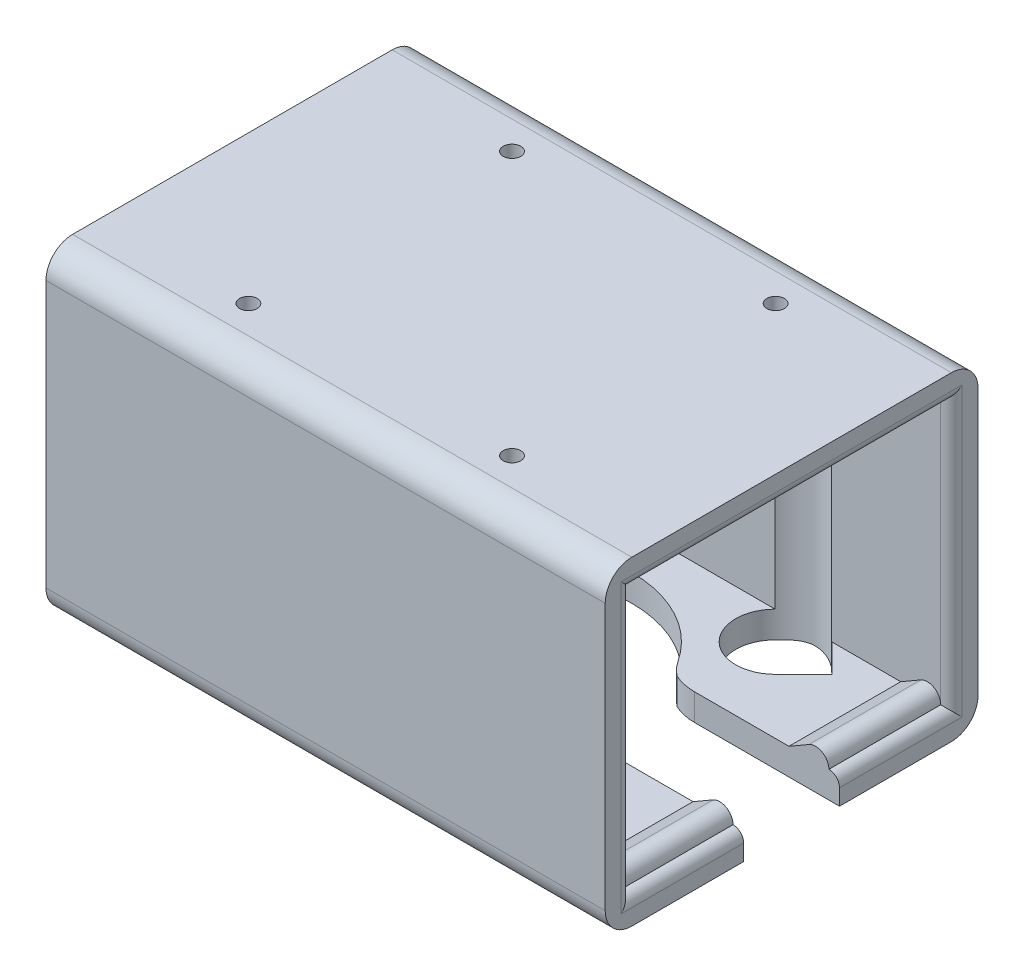
from build123d import *

# Parameters (mm, degrees)
EXTRUDE_1_DEPTH     = 5
SKETCH_3_W          = 100
SKETCH_3_H          = 5
SKETCH_3_W_2        = 5
SKETCH_3_H_2        = 60
EXTRUDE_2_DEPTH     = 55
SKETCH_4_W          = 60
SKETCH_4_H          = 5
EXTRUDE_3_DEPTH     = 100
CUT_EXTRUDE_1_REACH = 89.07
FILLET_2_R          = 10
FILLET_3_R          = 10
FILLET_4_R          = 5
FILLET_5_R          = 2
CUT_EXTRUDE_2_REACH = 85.703
SKETCH_6_R          = 1.65
CUT_EXTRUDE_START   = -50
CUT_EXTRUDE_3_DEPTH = 50
EXTRUDE_4_DEPTH     = 60
SKETCH_10_W         = 7.5
SKETCH_10_H         = 18
CUT_EXTRUDE_4_DEPTH = 5


# Read off the part's stored shape, not the designer's step: 切除-拉伸3
with BuildPart() as part:
    # 草图1 → 凸台-拉伸1 (new body)
    with BuildSketch(Plane(origin=(0, 0, 0), x_dir=(1, 0, 0), z_dir=(0, 1, 0))):
        Polygon((-52.5, 35), (-52.5, -35), (52.5, -35), (52.5, -9), (-20, -9), (-20, 9), (52.5, 9), (52.5, 35), align=None)
    extrude(amount=EXTRUDE_1_DEPTH)

    # 草图3 → 凸台-拉伸2 (add)
    with BuildSketch(Plane(origin=(0, 5, 0), x_dir=(1, 0, 0), z_dir=(0, 1, 0))):
        with Locations((2.5, 32.5)):
            Rectangle(SKETCH_3_W, SKETCH_3_H)
        with Locations((-50, 32.5)):
            Rectangle(SKETCH_3_W_2, SKETCH_3_H)
        with Locations((-50, 0)):
            Rectangle(SKETCH_3_W_2, SKETCH_3_H_2)
        with Locations((2.5, -32.5)):
            Rectangle(SKETCH_3_W, SKETCH_3_H)
        with Locations((-50, -32.5)):
            Rectangle(SKETCH_3_W_2, SKETCH_3_H)
    extrude(amount=EXTRUDE_2_DEPTH)

    # 草图4 → 凸台-拉伸3 (add)
    with BuildSketch(Plane(origin=(-47.5, 0, 0), x_dir=(0, 0, -1), z_dir=(1, 0, 0))):
        with Locations((0, 57.5)):
            Rectangle(SKETCH_4_W, SKETCH_4_H)
    extrude(amount=EXTRUDE_3_DEPTH)

    # 草图5 → 切除-拉伸1 (cut, up to next)
    with BuildSketch(Plane.XZ, mode=Mode.PRIVATE) as cut_extrude_1_sk1:
        with BuildLine():
            Line((19.852941176, 10.588235294), (0, 22.5))
            ThreePointArc((0, 22.5), (-22.5, 0), (0, -22.5))
            Line((0, -22.5), (19.852941176, -10.588235294))
            ThreePointArc((19.852941176, -10.588235294), (20.252840641, -9.801655267), (20.621590627, -9))
            Line((20.621590627, -9), (-20, -9))
            Line((-20, -9), (-20, 9))
            Line((-20, 9), (20.621590627, 9))
            ThreePointArc((20.621590627, 9), (20.252840641, 9.801655267), (19.852941176, 10.588235294))
        make_face()
    cut_extrude_1_tool1 = extrude(cut_extrude_1_sk1.sketch, amount=-CUT_EXTRUDE_1_REACH, mode=Mode.PRIVATE) & part.part
    # 草图5 → 切除-拉伸1 (cut, up to next)
    with BuildSketch(Plane.XZ, mode=Mode.PRIVATE) as cut_extrude_1_sk2:
        with BuildLine():
            Line((22.5, 9), (19.852941176, 10.588235294))
            ThreePointArc((19.852941176, 10.588235294), (20.252840641, 9.801655267), (20.621590627, 9))
            Line((20.621590627, 9), (22.5, 9))
        make_face()
    cut_extrude_1_tool2 = extrude(cut_extrude_1_sk2.sketch, amount=-CUT_EXTRUDE_1_REACH, mode=Mode.PRIVATE) & part.part
    # 草图5 → 切除-拉伸1 (cut, up to next)
    with BuildSketch(Plane.XZ, mode=Mode.PRIVATE) as cut_extrude_1_sk3:
        with BuildLine():
            ThreePointArc((20.621590627, -9), (20.252840641, -9.801655267), (19.852941176, -10.588235294))
            Line((19.852941176, -10.588235294), (22.5, -9))
            Line((22.5, -9), (20.621590627, -9))
        make_face()
    cut_extrude_1_tool3 = extrude(cut_extrude_1_sk3.sketch, amount=-CUT_EXTRUDE_1_REACH, mode=Mode.PRIVATE) & part.part
    # 草图5 → 切除-拉伸1 (cut, up to next)
    with BuildSketch(Plane.XZ, mode=Mode.PRIVATE) as cut_extrude_1_sk4:
        with BuildLine():
            ThreePointArc((19.852941176, 10.588235294), (11.576154497, 19.293590829), (0, 22.5))
            Line((0, 22.5), (19.852941176, 10.588235294))
        make_face()
    cut_extrude_1_tool4 = extrude(cut_extrude_1_sk4.sketch, amount=-CUT_EXTRUDE_1_REACH, mode=Mode.PRIVATE) & part.part
    # 草图5 → 切除-拉伸1 (cut, up to next)
    with BuildSketch(Plane.XZ, mode=Mode.PRIVATE) as cut_extrude_1_sk5:
        with BuildLine():
            Line((19.852941176, -10.588235294), (0, -22.5))
            ThreePointArc((0, -22.5), (11.576154497, -19.293590829), (19.852941176, -10.588235294))
        make_face()
    cut_extrude_1_tool5 = extrude(cut_extrude_1_sk5.sketch, amount=-CUT_EXTRUDE_1_REACH, mode=Mode.PRIVATE) & part.part
    add(cut_extrude_1_tool1.solids().sort_by_distance((19.691832, 0, -9.530147))[0], mode=Mode.SUBTRACT)
    add(cut_extrude_1_tool2.solids().sort_by_distance((21.001859, 0, 9.525708))[0], mode=Mode.SUBTRACT)
    add(cut_extrude_1_tool3.solids().sort_by_distance((21.001859, 0, -9.525708))[0], mode=Mode.SUBTRACT)
    add(cut_extrude_1_tool4.solids().sort_by_distance((10.590548, 0, 17.650913))[0], mode=Mode.SUBTRACT)
    add(cut_extrude_1_tool5.solids().sort_by_distance((10.590548, 0, -17.650913))[0], mode=Mode.SUBTRACT)

    # 圆角2
    # the kernel refuses this fillet: 10 mm, written as the material it takes off along each edge
    with BuildSketch(Plane(origin=(19.852941176, -6.249770084, 10.588235294), x_dir=(-0.5108705169858321, 0, 0.8596576730737815), z_dir=(0, 1, 0))) as fillet_2_piece_1:
        with BuildLine():
            CenterArc((2.542282374, 9.989311313), FILLET_2_R, 241.685588385, 25.665066698)
            Line((-2.200814232, 1.185730531), (0, 0))
            ThreePointArc((0, 0), (1.040024608, 0.024049546), (2.080049215, 0))
        make_face()
    extrude(amount=17.499540168, mode=Mode.SUBTRACT)
    with BuildSketch(Plane(origin=(22.5, -6.924599124, 9), x_dir=(1, 0, 0), z_dir=(0, 1, 0))) as fillet_2_piece_2:
        with BuildLine():
            CenterArc((FILLET_2_R * 0.276983964948, -FILLET_2_R), FILLET_2_R, 90, 30.963756532)
            Line((-FILLET_2_R * 0.237511790479, -FILLET_2_R * 0.142507074287), (0, 0))
            Line((0, 0), (FILLET_2_R * 0.276983964948, 0))
        make_face()
    extrude(amount=18.849198247, mode=Mode.SUBTRACT)

    # 圆角3
    # the kernel refuses this fillet: 10 mm, written as the material it takes off along each edge
    with BuildSketch(Plane(origin=(22.5, -6.924599124, -9), x_dir=(1, 0, 0), z_dir=(0, 1, 0))) as fillet_3_piece_1:
        with BuildLine():
            CenterArc((FILLET_3_R * 0.276983964948, FILLET_3_R), FILLET_3_R, 239.036243468, 30.963756532)
            Line((-FILLET_3_R * 0.237511790479, FILLET_3_R * 0.142507074287), (0, 0))
            Line((0, 0), (FILLET_3_R * 0.276983964948, 0))
        make_face()
    extrude(amount=18.849198247, mode=Mode.SUBTRACT)
    with BuildSketch(Plane(origin=(19.852941176, -6.249770084, -10.588235294), x_dir=(0.857492925712544, 0, 0.5144957554275268), z_dir=(0, 1, 0))) as fillet_3_piece_2:
        with BuildLine():
            CenterArc((2.499908034, 10), FILLET_3_R, 244.334933302, 25.665066698)
            ThreePointArc((-1.83118813, 0.986587437), (-0.904187133, 0.514465931), (0, 0))
            Line((0, 0), (2.499908034, 0))
        make_face()
    extrude(amount=17.499540168, mode=Mode.SUBTRACT)

    # 圆角4
    fillet_4_edges = [part.edges().sort_by_distance(p)[0] for p in [
        (0, 0, 35),
        (0, 0, -35),
        (0, 60, -35),
        (0, 60, 35),
    ]]
    fillet(fillet_4_edges, radius=FILLET_4_R)

    # 圆角5
    fillet_5_edges = [part.edges().sort_by_distance(p)[0] for p in [
        (52.5, 5, 19.5),
        (52.5, 5, -19.5),
        (52.5, 30, -30),
        (52.5, 30, 30),
        (52.5, 55, 0),
    ]]
    fillet(fillet_5_edges, radius=FILLET_5_R)

    # 草图6 → 切除-拉伸2 (cut, up to next)
    with BuildSketch(Plane.XZ.offset(-55), mode=Mode.PRIVATE) as cut_extrude_2_sk1:
        with Locations(Location((-24.75, 24.75, 0), (0, 0, 270))):
            Circle(SKETCH_6_R)
    cut_extrude_2_tool1 = extrude(cut_extrude_2_sk1.sketch, amount=-CUT_EXTRUDE_2_REACH, mode=Mode.PRIVATE) & part.part
    # 草图6 → 切除-拉伸2 (cut, up to next)
    with BuildSketch(Plane.XZ.offset(-55), mode=Mode.PRIVATE) as cut_extrude_2_sk2:
        with Locations(Location((24.75, 24.75, 0), (0, 0, 270))):
            Circle(SKETCH_6_R)
    cut_extrude_2_tool2 = extrude(cut_extrude_2_sk2.sketch, amount=-CUT_EXTRUDE_2_REACH, mode=Mode.PRIVATE) & part.part
    # 草图6 → 切除-拉伸2 (cut, up to next)
    with BuildSketch(Plane.XZ.offset(-55), mode=Mode.PRIVATE) as cut_extrude_2_sk3:
        with Locations(Location((24.75, -24.75, 0), (0, 0, 270))):
            Circle(SKETCH_6_R)
    cut_extrude_2_tool3 = extrude(cut_extrude_2_sk3.sketch, amount=-CUT_EXTRUDE_2_REACH, mode=Mode.PRIVATE) & part.part
    # 草图6 → 切除-拉伸2 (cut, up to next)
    with BuildSketch(Plane.XZ.offset(-55), mode=Mode.PRIVATE) as cut_extrude_2_sk4:
        with Locations(Location((-24.75, -24.75, 0), (0, 0, 270))):
            Circle(SKETCH_6_R)
    cut_extrude_2_tool4 = extrude(cut_extrude_2_sk4.sketch, amount=-CUT_EXTRUDE_2_REACH, mode=Mode.PRIVATE) & part.part
    add(cut_extrude_2_tool1.solids().sort_by_distance((-24.75, 55, 24.75))[0], mode=Mode.SUBTRACT)
    add(cut_extrude_2_tool2.solids().sort_by_distance((24.75, 55, 24.75))[0], mode=Mode.SUBTRACT)
    add(cut_extrude_2_tool3.solids().sort_by_distance((24.75, 55, -24.75))[0], mode=Mode.SUBTRACT)
    add(cut_extrude_2_tool4.solids().sort_by_distance((-24.75, 55, -24.75))[0], mode=Mode.SUBTRACT)

    # 切除-拉伸3 outline → 切除-拉伸3 (cut)
    with BuildSketch(Plane.XZ.offset(CUT_EXTRUDE_START)):
        with BuildLine():
            Line((30, 19.393928679), (35.25210063, 24.75))
            Line((35.25210063, 24.75), (30.106071321, 30))
            ThreePointArc((30.106071321, 30), (17.250375047, 24.82500375), (30, 19.393928679))
        make_face()
        with BuildLine():
            Line((-14.143398282, 24.75), (-19.393398282, 30))
            Line((-19.393398282, 30), (-19.5, 30))
            Line((-19.5, 30), (-19.446699141, 30.053300859))
            ThreePointArc((-19.446699141, 30.053300859), (-32.25, 24.75), (-19.446699141, 19.446699141))
            Line((-19.446699141, 19.446699141), (-14.143398282, 24.75))
        make_face()
        with BuildLine():
            Line((-19.5, -30), (-19.393398282, -30))
            Line((-19.393398282, -30), (-14.143398282, -24.75))
            Line((-14.143398282, -24.75), (-19.446699141, -19.446699141))
            ThreePointArc((-19.446699141, -19.446699141), (-32.25, -24.75), (-19.446699141, -30.053300859))
            Line((-19.446699141, -30.053300859), (-19.5, -30))
        make_face()
        with BuildLine():
            Line((35.356601718, -24.75), (30.053300859, -19.446699141))
            ThreePointArc((30.053300859, -19.446699141), (17.25, -24.75), (30.053300859, -30.053300859))
            Line((30.053300859, -30.053300859), (30, -30))
            Line((30, -30), (30.106601718, -30))
            Line((30.106601718, -30), (35.356601718, -24.75))
        make_face()
    extrude(amount=CUT_EXTRUDE_3_DEPTH, mode=Mode.SUBTRACT)

    # 草图9 → 凸台-拉伸4 (add)
    with BuildSketch(Plane(origin=(0, 0, 30), x_dir=(-1, 0, 0), z_dir=(0, 0, -1))):
        with BuildLine():
            Line((-43, 5), (-46.75, 7.165063509))
            ThreePointArc((-46.75, 7.165063509), (-45.834936491, 6.25), (-45.5, 5))
            Line((-45.5, 5), (-43, 5))
        make_face()
        with BuildLine():
            ThreePointArc((-46.75, 7.165063509), (-49.25, 7.165063509), (-50.5, 5))
            Line((-50.5, 5), (-48, 5))
            Line((-48, 5), (-46.75, 7.165063509))
        make_face()
        with BuildLine():
            Line((-46.75, 7.165063509), (-48, 5))
            Line((-48, 5), (-45.5, 5))
            ThreePointArc((-45.5, 5), (-45.834936491, 6.25), (-46.75, 7.165063509))
        make_face()
    extrude(amount=EXTRUDE_4_DEPTH)

    # 草图10 → 切除-拉伸4 (cut)
    with BuildSketch(Plane.XZ.offset(-5)):
        with Locations((46.75, 0)):
            Rectangle(SKETCH_10_W, SKETCH_10_H)
    extrude(amount=-CUT_EXTRUDE_4_DEPTH, mode=Mode.SUBTRACT)


solid = part.part
